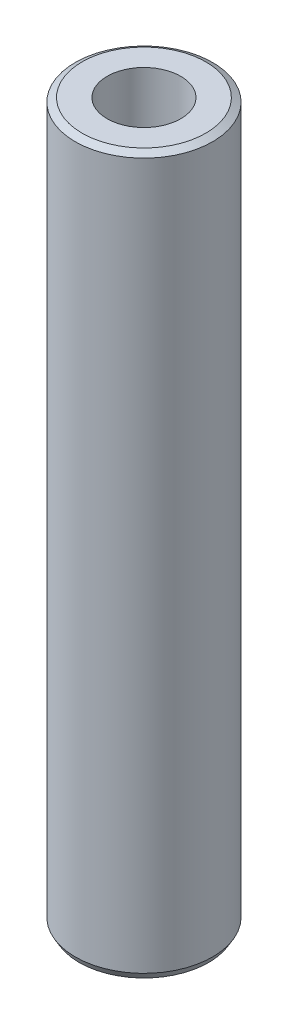
from build123d import *
from OCP.BRepFilletAPI import BRepFilletAPI_MakeChamfer

# Parameters (mm, degrees)
SKETCH1_R           = 57.5
BOSS_EXTRUDE1_DEPTH = 600
SKETCH2_R           = 30.813934022
CUT_EXTRUDE1_DEPTH  = 606.485342515
CHAMFER1_SIZE       = 3.308245054
CHAMFER1_SIZE2      = 5.730048517


with BuildPart() as part:
    # Sketch1 → Boss-Extrude1 (new body)
    with BuildSketch(Plane(origin=(0, 0, 0), x_dir=(1, 0, 0), z_dir=(0, 1, 0))):
        Circle(SKETCH1_R)
    extrude(amount=BOSS_EXTRUDE1_DEPTH)

    # Sketch2 → Cut-Extrude1 (cut, through all)
    with BuildSketch(Plane(origin=(0, 0, 0), x_dir=(1, 0, 0), z_dir=(0, 1, 0))):
        Circle(SKETCH2_R)
    extrude(amount=CUT_EXTRUDE1_DEPTH, mode=Mode.SUBTRACT)

    # Chamfer1: one chamfer whose edges measure the first distance from different faces: ONE call of the kernel's chamfer builder (chamfer() names one face for all edges)
    chamfer1_edges_1 = [part.edges().sort_by_distance(p)[0] for p in [
        (-57.5, 600, 0),
    ]]
    chamfer1_side_1 = [part.faces().sort_by_distance(p)[0] for p in [
        (-57.5, 300, 0),
    ]]
    chamfer1_edges_2 = [part.edges().sort_by_distance(p)[0] for p in [
        (-57.5, 0, 0),
    ]]
    chamfer1_side_2 = [part.faces().sort_by_distance(p)[0] for p in [
        (-55.873654403, 0, 0),
    ]]
    chamfer1 = BRepFilletAPI_MakeChamfer(part.part.solid().wrapped)
    for e in chamfer1_edges_1:
        chamfer1.Add(CHAMFER1_SIZE, CHAMFER1_SIZE2, e.wrapped, chamfer1_side_1[0].wrapped)  # the first distance lies on this face
    for e in chamfer1_edges_2:
        chamfer1.Add(CHAMFER1_SIZE, CHAMFER1_SIZE2, e.wrapped, chamfer1_side_2[0].wrapped)  # the first distance lies on this face
    add(Compound.cast(chamfer1.Shape()), mode=Mode.REPLACE)


solid = part.part
